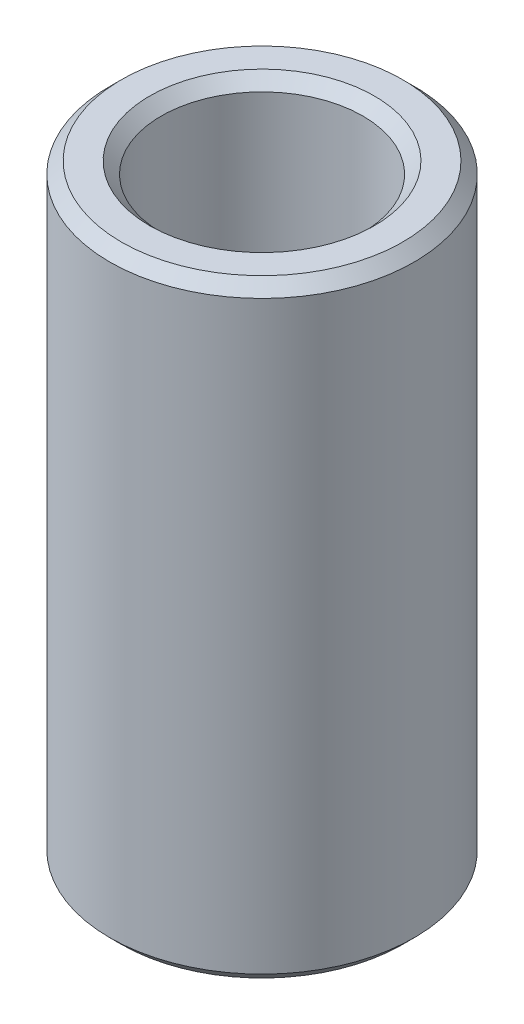
from build123d import *

# Parameters (mm, degrees)
SKETCH1_R           = 35
BOSS_EXTRUDE1_DEPTH = 139.860274032
SKETCH2_R           = 23.18480721
CUT_EXTRUDE1_DEPTH  = 149.360696454
CHAMFER1_SIZE       = 2.656047607


with BuildPart() as part:
    # Sketch1 → Boss-Extrude1 (new body)
    with BuildSketch(Plane(origin=(0, 0, 0), x_dir=(1, 0, 0), z_dir=(0, 1, 0))):
        Circle(SKETCH1_R)
    extrude(amount=BOSS_EXTRUDE1_DEPTH)

    # Sketch2 → Cut-Extrude1 (cut, through all)
    with BuildSketch(Plane(origin=(0, 0, 0), x_dir=(1, 0, 0), z_dir=(0, 1, 0))):
        Circle(SKETCH2_R)
    extrude(amount=CUT_EXTRUDE1_DEPTH, mode=Mode.SUBTRACT)

    # Chamfer1
    chamfer1_edges = [part.edges().sort_by_distance(p)[0] for p in [
        (-23.18480721, 139.860274032, 0),
        (-23.18480721, 0, 0),
        (-35, 0, 0),
        (-35, 139.860274032, 0),
    ]]
    chamfer(chamfer1_edges, length=CHAMFER1_SIZE)


solid = part.part
